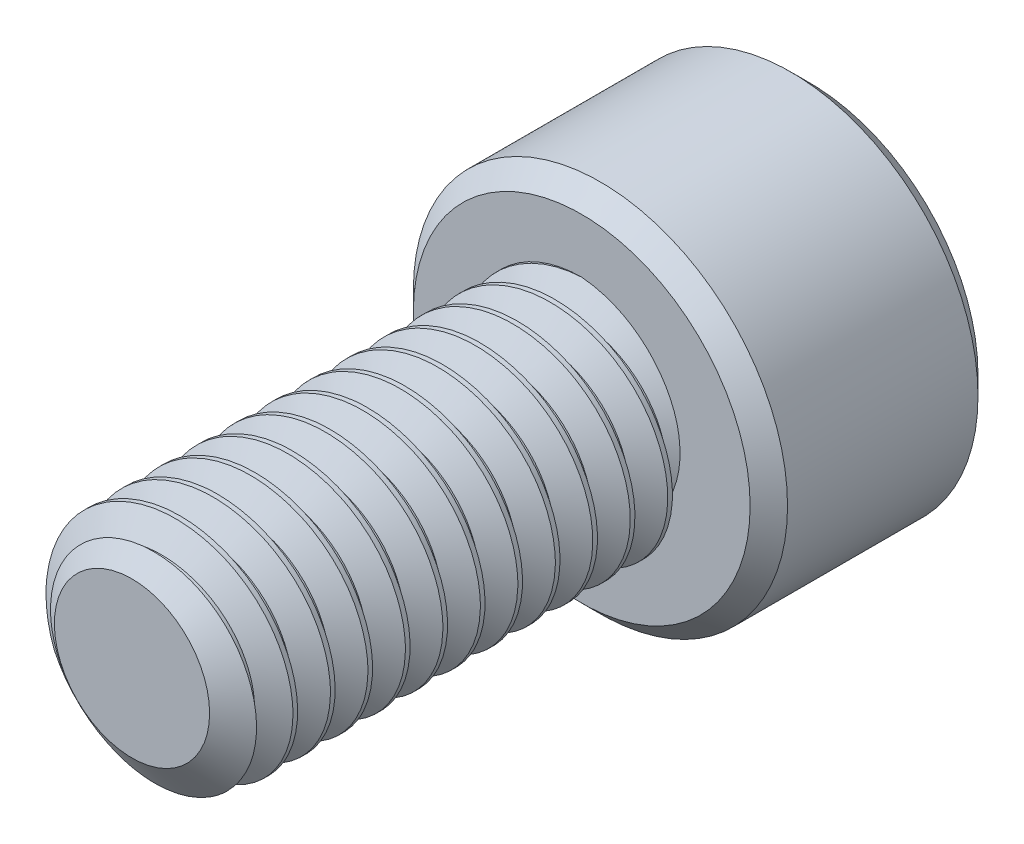
from build123d import *

# Parameters (mm, degrees)
SKETCH1_R          = 2.413
EXTRUDE1_DEPTH     = 9.525
CUT_SWEEP1_PITCH   = 0.79375
SKETCH6_R          = 3.9624
EXTRUDE2_DEPTH     = 4.826
CUT_EXTRUDE1_DEPTH = 2.9765625
CHAMFER1_SIZE      = 0.39624


with BuildPart() as part:
    # Sketch1 → Extrude1 (new body)
    with BuildSketch(Plane.XY):
        Circle(SKETCH1_R)
    extrude(amount=-EXTRUDE1_DEPTH)

    # Cut-Sweep1: the profile of Sketch3 profile screwed along a right-hand helix of 13 turns, 6 arcs to a turn; built about Z, then put on its axis
    cut_sweep1_z = Axis((0, 0, 0), (0, 0, 1))
    cut_sweep1_corners = [(2.4133, 0, -0.694704455), (1.897444252, 0, -0.396875), (1.897444252, 0, -0.29765625), (2.4133, 0, 0.000173205)]
    with BuildLine(mode=Mode.PRIVATE) as cut_sweep1_profile:
        Line(cut_sweep1_corners[0], cut_sweep1_corners[1])
        Line(cut_sweep1_corners[1], cut_sweep1_corners[2])
        Line(cut_sweep1_corners[2], cut_sweep1_corners[3])
        Line(cut_sweep1_corners[3], cut_sweep1_corners[0])
    cut_sweep1_cap = Face(cut_sweep1_profile.wire())
    cut_sweep1_turn_angles = [0, 30, 60, 90, 120, 150, 180, 210, 240, 270, 300, 330, 360]
    cut_sweep1_turn_weights = [1, 0.8660254037844387, 1, 0.8660254037844387, 1, 0.8660254037844387, 1, 0.8660254037844387, 1, 0.8660254037844387, 1, 0.8660254037844387, 1]
    cut_sweep1_turn_rails = [Edge.make_bspline([Vector(p[0], p[1], 0).rotate(cut_sweep1_z, cut_sweep1_turn_angles[k]) / cut_sweep1_turn_weights[k] + Vector(0, 0, p[2] + CUT_SWEEP1_PITCH * cut_sweep1_turn_angles[k] / 360) for k in range(13)], [0, 0, 0, 1, 1, 2, 2, 3, 3, 4, 4, 5, 5, 6, 6, 6], 2, cut_sweep1_turn_weights) for p in cut_sweep1_corners]
    cut_sweep1_turn_sides = [Face.make_surface_from_curves(cut_sweep1_turn_rails[p[0]], cut_sweep1_turn_rails[p[1]]) for p in [(0, 1), (1, 2), (2, 3), (3, 0)]]
    cut_sweep1 = Plane(origin=(0, 0, 0), x_dir=(0, 1, 0), z_dir=(0, 0, -1)) * Solid(Shell([*[p.moved(Location((0, 0, CUT_SWEEP1_PITCH * i))) for i in range(13) for p in cut_sweep1_turn_sides], cut_sweep1_cap, cut_sweep1_cap.rotate(cut_sweep1_z, 4680).moved(Location((0, 0, CUT_SWEEP1_PITCH * 4680 / 360)))]))
    add(cut_sweep1, mode=Mode.SUBTRACT)

    # Sketch4 → Cut-Revolve1 (revolve, cut)
    with BuildSketch(Plane(origin=(0, 0, 0), x_dir=(0, 0, -1), z_dir=(1, 0, 0)), mode=Mode.PRIVATE) as cut_revolve1_sk:
        Polygon((0.538848736, 2.413), (0, 1.643444252), (0, 2.413), align=None)
    revolve(cut_revolve1_sk.sketch.rotate(Axis((0, 0, 0), (0, 0, -1)), 261.048315518), axis=Axis((0, 0, 0), (0, 0, -1)), mode=Mode.SUBTRACT)

    # Sketch6 → Extrude2 (add)
    with BuildSketch(Plane(origin=(0, 0, -9.525), x_dir=(-1, 0, 0), z_dir=(0, 0, -1))):
        Circle(SKETCH6_R)
    extrude(amount=EXTRUDE2_DEPTH)

    # Sketch7 → Cut-Extrude1 (cut)
    with BuildSketch(Plane(origin=(0, 0, -14.351), x_dir=(-1, 0, 0), z_dir=(0, 0, -1))):
        Polygon((0, 2.291358881), (-1.984375, 1.14567944), (-1.984375, -1.14567944), (0, -2.291358881), (1.984375, -1.14567944), (1.984375, 1.14567944), align=None)
    extrude(amount=-CUT_EXTRUDE1_DEPTH, mode=Mode.SUBTRACT)

    # Cut-Extrude2 cone 1 section (through the dimple's axis) → Cut-Extrude2 (revolve, cut)
    with BuildSketch(Plane(origin=(0, 0, -14.351), x_dir=(0, 1, 0), z_dir=(1, 0, 0))):
        Polygon((0, 0), (2.291358881, 0), (0, 2.291358881), align=None)
    revolve(axis=Axis((0, 0, -14.351), (0, 0, 1)), mode=Mode.SUBTRACT)

    # Chamfer1
    chamfer1_edges = [part.edges().sort_by_distance(p)[0] for p in [
        (3.9624, 0, -9.525),
        (3.9624, 0, -14.351),
    ]]
    chamfer(chamfer1_edges, length=CHAMFER1_SIZE)


solid = part.part
